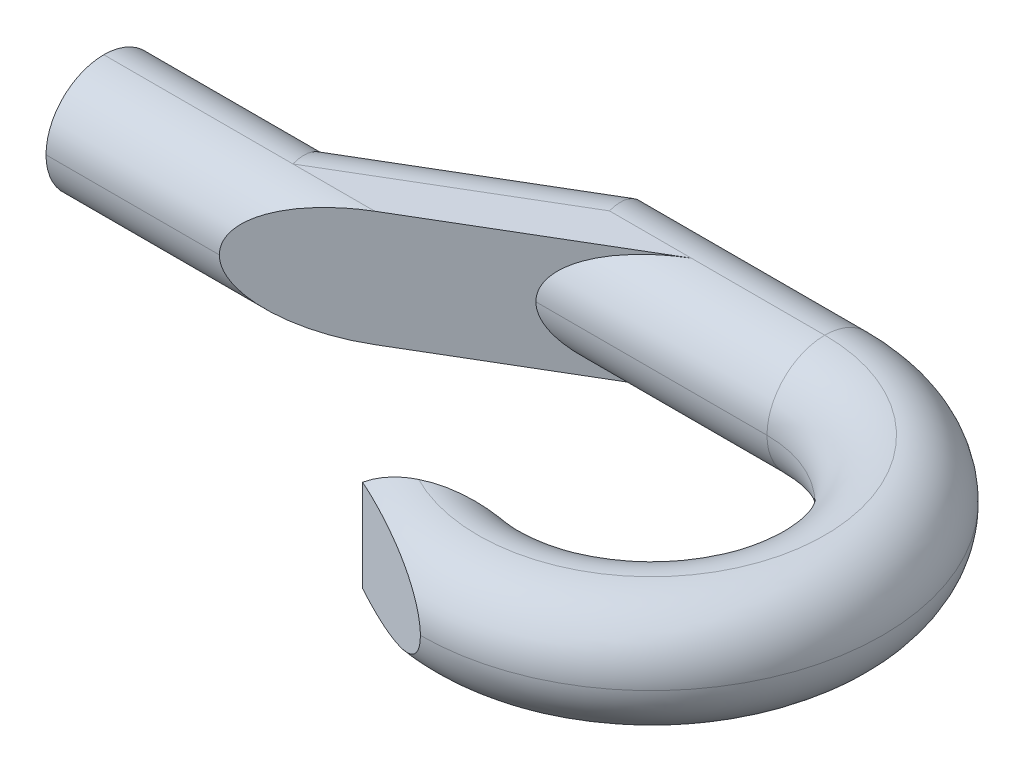
from build123d import *

# Parameters (mm, degrees)
EXTRUDE_1_DEPTH     = 10
FILLET_5_R          = 5
FILLET_6_R          = 5
SKETCH_22_R         = 2.8
CUT_EXTRUDE_1_DEPTH = 3.4


with BuildPart() as part:
    # Эскиз2 → Бобышка-Вытянуть1 (new body)
    with BuildSketch(Plane(origin=(0, 0, 0), x_dir=(1, 0, 0), z_dir=(0, 1, 0))):
        with BuildLine():
            Line((10, -25), (20, -20))
            ThreePointArc((20, -20), (30, -10), (20, 0))
            Line((20, 0), (0, 0))
            Line((0, 0), (-17.215189328, -10.180238524))
            Line((-17.215189328, -10.180238524), (-32.215189328, -10.180238524))
            Line((-32.215189328, -10.180238524), (-32.215189328, -0.180238524))
            Line((-32.215189328, -0.180238524), (-17.215189328, -0.180238524))
            Line((-17.215189328, -0.180238524), (0, 10))
            Line((0, 10), (20, 10))
            ThreePointArc((20, 10), (40, -10), (20, -30))
            Line((20, -30), (10, -25))
        make_face()
    extrude(amount=EXTRUDE_1_DEPTH)

    # Скругление5
    fillet_5_edges = [part.edges().sort_by_distance(p)[0] for p in [
        (30, 10, 10),
        (30, 0, 10),
        (10, 10, 0),
        (10, 0, 0),
        (-24.715189328, 10, 10.180238524),
        (-24.715189328, 0, 10.180238524),
    ]]
    fillet(fillet_5_edges, radius=FILLET_5_R - 0.0001)  # a hair under: the kernel refuses the full size

    # Скругление6
    fillet_6_edges = [part.edges().sort_by_distance(p)[0] for p in [
        (40, 10, 10),
        (40, 0, 10),
        (10, 10, -10),
        (10, 0, -10),
        (-8.607594664, 10, -4.909880738),
        (-8.607594664, 0, -4.909880738),
        (-24.715189328, 10, 0.180238524),
        (-24.715189328, 0, 0.180238524),
    ]]
    fillet(fillet_6_edges, radius=FILLET_6_R - 0.0001)  # a hair under: the kernel refuses the full size

    # Эскиз22 → Вырез-Вытянуть1 (cut)
    with BuildSketch(Plane.ZY.offset(32.215189328)):
        with Locations((5.180238524, 5)):
            Circle(SKETCH_22_R)
    extrude(amount=-CUT_EXTRUDE_1_DEPTH, mode=Mode.SUBTRACT)


solid = part.part
